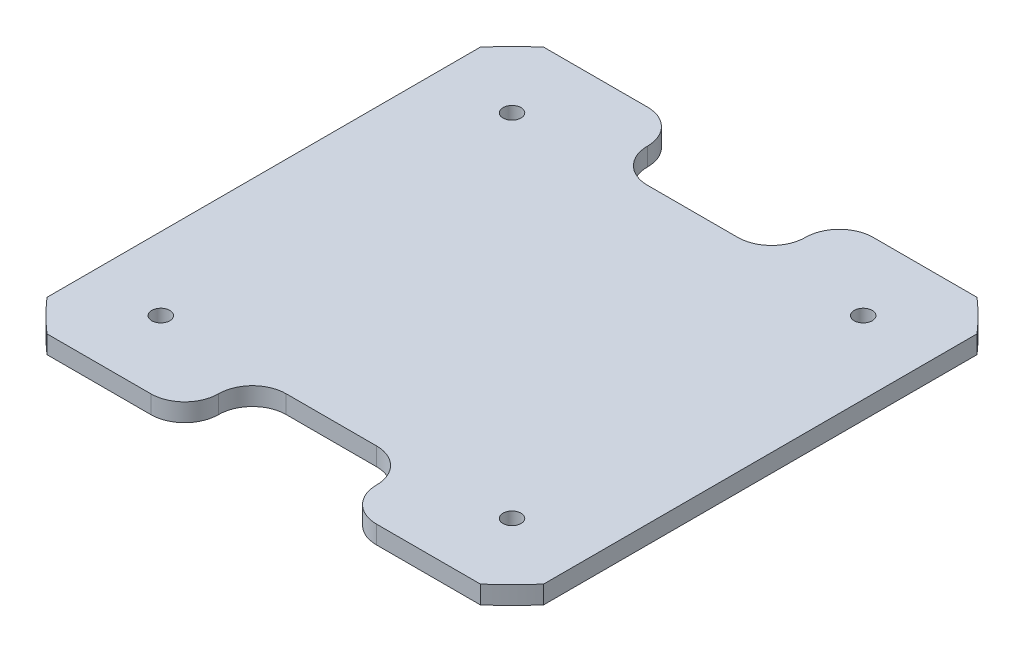
from build123d import *

# Parameters (mm, degrees)
BOSS_EXTRUDE1_DEPTH   = 4
F_4_0MM_DOWEL_HOLE2_D = 4
FILLET1_START         = -1
FILLET1_DEPTH         = 6
FILLET1_2_DEPTH       = 4


with BuildPart() as part:
    # Sketch1 → Boss-Extrude1 (new body)
    with BuildSketch(Plane(origin=(0, 0, 0), x_dir=(1, 0, 0), z_dir=(0, 1, 0))):
        with BuildLine():
            Line((55, 48), (55, -48))
            ThreePointArc((55, -48), (51.618795027, -51.618795027), (48, -55))
            Line((48, -55), (17.5, -55))
            Line((17.5, -55), (17.5, -40))
            Line((17.5, -40), (-17.5, -40))
            Line((-17.5, -40), (-17.5, -55))
            Line((-17.5, -55), (-48, -55))
            ThreePointArc((-48, -55), (-51.618795027, -51.618795027), (-55, -48))
            Line((-55, -48), (-55, 48))
            ThreePointArc((-55, 48), (-51.618795027, 51.618795027), (-48, 55))
            Line((-48, 55), (-17.5, 55))
            Line((-17.5, 55), (-17.5, 40))
            Line((-17.5, 40), (17.5, 40))
            Line((17.5, 40), (17.5, 55))
            Line((17.5, 55), (48, 55))
            ThreePointArc((48, 55), (51.618795027, 51.618795027), (55, 48))
        make_face()
    extrude(amount=BOSS_EXTRUDE1_DEPTH)

    # Ø4.0mm Dowel Hole2 (through all)
    with Locations(Plane(origin=(0, 4, 0), x_dir=(1, 0, 0), z_dir=(0, 1, 0))):
        with Locations((38.890872965, 38.890872965), (38.890872965, -38.890872965), (-38.890872965, -38.890872965), (-38.890872965, 38.890872965)):
            Hole(F_4_0MM_DOWEL_HOLE2_D / 2)

    # Fillet1: read off the stored shape, not the designer's step
    # Fillet1 outline → Fillet1 (cut)
    with BuildSketch(Plane(origin=(0, 0, 0), x_dir=(1, 0, 0), z_dir=(0, 1, 0)).offset(FILLET1_START)):
        with BuildLine():
            Line((17.5, 55), (17.5, 47.5))
            ThreePointArc((17.5, 47.5), (19.696699141, 52.803300859), (25, 55))
            Line((25, 55), (17.5, 55))
        make_face()
        with BuildLine():
            ThreePointArc((-25, 55), (-19.696699141, 52.803300859), (-17.5, 47.5))
            Line((-17.5, 47.5), (-17.5, 55))
            Line((-17.5, 55), (-25, 55))
        make_face()
        with BuildLine():
            Line((-17.5, -55), (-17.5, -47.5))
            ThreePointArc((-17.5, -47.5), (-19.696699141, -52.803300859), (-25, -55))
            Line((-25, -55), (-17.5, -55))
        make_face()
        with BuildLine():
            ThreePointArc((25, -55), (19.696699141, -52.803300859), (17.5, -47.5))
            Line((17.5, -47.5), (17.5, -55))
            Line((17.5, -55), (25, -55))
        make_face()
    extrude(amount=FILLET1_DEPTH, mode=Mode.SUBTRACT)

    # Fillet1 2 outline → Fillet1 2 (add)
    with BuildSketch(Plane(origin=(0, 0, 0), x_dir=(1, 0, 0), z_dir=(0, 1, 0))):
        with BuildLine():
            Line((-17.5, 40), (-10, 40))
            ThreePointArc((-10, 40), (-15.303300859, 42.196699141), (-17.5, 47.5))
            Line((-17.5, 47.5), (-17.5, 40))
        make_face()
        with BuildLine():
            ThreePointArc((17.5, 47.5), (15.303300859, 42.196699141), (10, 40))
            Line((10, 40), (17.5, 40))
            Line((17.5, 40), (17.5, 47.5))
        make_face()
        with BuildLine():
            Line((17.5, -40), (10, -40))
            ThreePointArc((10, -40), (15.303300859, -42.196699141), (17.5, -47.5))
            Line((17.5, -47.5), (17.5, -40))
        make_face()
        with BuildLine():
            ThreePointArc((-17.5, -47.5), (-15.303300859, -42.196699141), (-10, -40))
            Line((-10, -40), (-17.5, -40))
            Line((-17.5, -40), (-17.5, -47.5))
        make_face()
    extrude(amount=FILLET1_2_DEPTH)


solid = part.part
